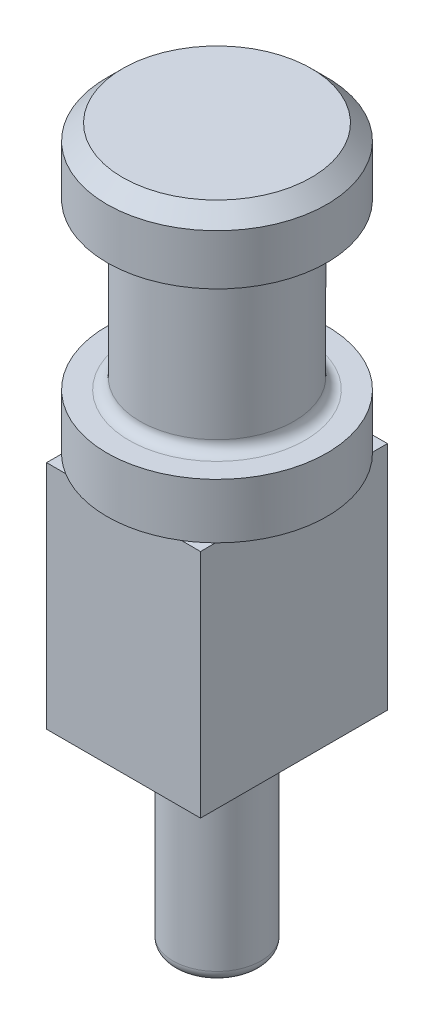
from build123d import *

# Parameters (mm, degrees)
FILLET1_R           = 1
FILLET2_R           = 1
SKETCH2_W           = 14
SKETCH2_H           = 21
BOSS_EXTRUDE1_DEPTH = 17


with BuildPart() as part:
    # Sketch1 → Revolve1 (revolve)
    with BuildSketch(Plane.XY):
        Polygon((0, 45.954584836), (8.585786438, 45.954584836), (10, 44.540371274), (10, 39.954584836), (7, 39.954584836), (7, 24.954584836), (10, 24.954584836), (10, 19.954584836), (7, 19.954584836), (7, -1.045415164), (4, -1.045415164), (4, -19.045415164), (0, -19.045415164), align=None)
    revolve(axis=Axis((0, 45.954584836, 0), (0, -1, 0)))

    # Fillet1
    fillet1_edges = [part.edges().sort_by_distance(p)[0] for p in [
        (-4, -19.045415164, 0),
    ]]
    fillet(fillet1_edges, radius=FILLET1_R)

    # Fillet2
    fillet2_edges = [part.edges().sort_by_distance(p)[0] for p in [
        (-7, 24.954584836, 0),
        (-7, 39.954584836, 0),
    ]]
    fillet(fillet2_edges, radius=FILLET2_R)

    # Sketch2 → Boss-Extrude1 (add)
    with BuildSketch(Plane.XY.offset(8.5)):
        with Locations((0, 9.454584836)):
            Rectangle(SKETCH2_W, SKETCH2_H)
    extrude(amount=-BOSS_EXTRUDE1_DEPTH)


solid = part.part
